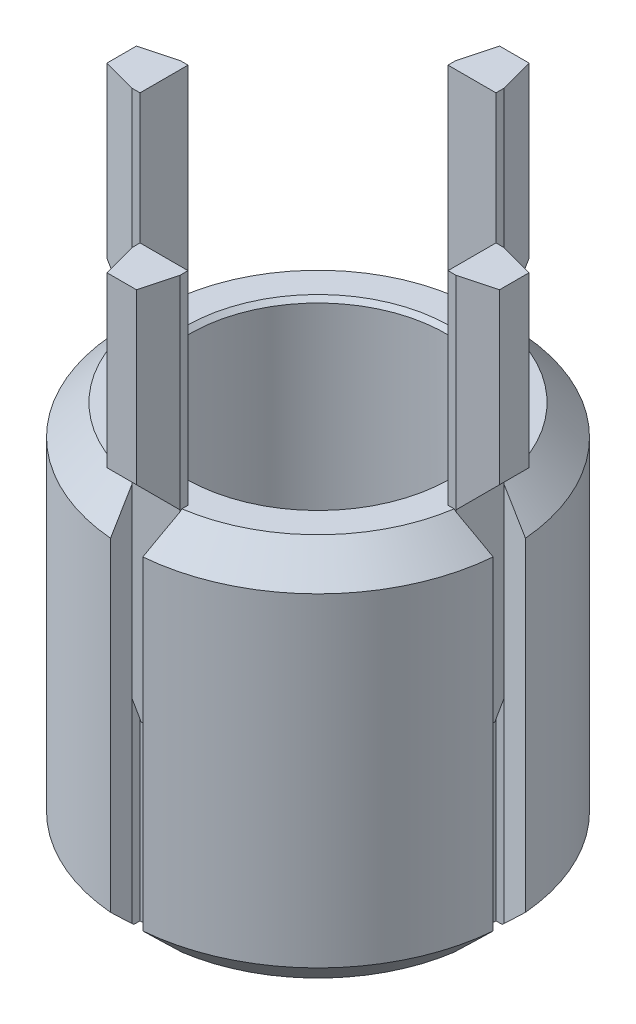
from build123d import *

# Parameters (mm, degrees)
SKETCH3_R           = 6
EXTRUDE1_DEPTH      = 12
CHAMFER1_SIZE       = 0.9375
EXTRUDE2_DEPTH      = 15.696938457
CIRPATTERN1_COUNT   = 4
SKETCH6_R           = 4
EXTRUDE3_DEPTH      = 15.679610971
SKETCH12_W          = 0.25
SKETCH12_H          = 1.5
EXTRUDE6_DEPTH      = 6.35
EXTRUDE7_DEPTH      = 6.35
EXTRUDE8_DEPTH      = 15.744069903
EXTRUDE8_DEPTH_BACK = 15.744069903
EXTRUDE9_DEPTH      = 18.368211193
CIRPATTERN2_COUNT   = 4


# Read off the part's stored shape, not the designer's step: Extrude4, Extrude5
with BuildPart() as part:
    # Sketch3 → Extrude1 (new body)
    with BuildSketch(Plane(origin=(0, 0, 0), x_dir=(1, 0, 0), z_dir=(0, 1, 0))):
        with Locations(Location((0, 0, 0), (0, 0, 270))):
            Circle(SKETCH3_R)
    extrude(amount=-EXTRUDE1_DEPTH)

    # Chamfer1
    chamfer1_edges = [part.edges().sort_by_distance(p)[0] for p in [
        (0, 0, -6),
        (0, -12, -6),
    ]]
    chamfer(chamfer1_edges, length=CHAMFER1_SIZE)

    # Sketch11 → Extrude2 (cut, through all)
    with BuildSketch(Plane(origin=(0, 0, 0), x_dir=(1, 0, 0), z_dir=(0, 1, 0))):
        Polygon((-6, 0.498797632), (-5.0625, 0.75), (-4.8125, 0.75), (-4.8125, -0.75), (-5.0625, -0.75), (-6, -0.498797632), align=None)
    extrude2 = extrude(amount=-EXTRUDE2_DEPTH, mode=Mode.SUBTRACT)

    # CirPattern1: Extrude2 ×4 about axis
    cirpattern1_axis = Axis((0, 0, 0), (0, 1, 0))
    for i in range(1, CIRPATTERN1_COUNT):
        add(extrude2.rotate(cirpattern1_axis, i * 360 / CIRPATTERN1_COUNT), mode=Mode.SUBTRACT)

    # Sketch6 → Extrude3 (cut, through all)
    with BuildSketch(Plane(origin=(0, 0, 0), x_dir=(1, 0, 0), z_dir=(0, 1, 0))):
        with Locations(Location((0, 0, 0), (0, 0, 270))):
            Circle(SKETCH6_R)
    extrude(amount=-EXTRUDE3_DEPTH, mode=Mode.SUBTRACT)

    # Extrude4 outline → Extrude4 (revolve, cut)
    with BuildSketch(Plane.XY):
        Polygon((4, 0), (4, -0.135316469), (4.135316469, 0), align=None)
    revolve(axis=Axis((0, 0, 0), (0, 1, 0)), mode=Mode.SUBTRACT)

    # Extrude5 outline → Extrude5 (revolve, cut)
    with BuildSketch(Plane.XY):
        Polygon((4.135316469, -12), (4, -11.864683531), (4, -12), align=None)
    revolve(axis=Axis((0, 0, 0), (0, 1, 0)), mode=Mode.SUBTRACT)


with BuildPart() as body_2:
    # Sketch12 → Extrude6 (new, symmetric)
    with BuildSketch(Plane(origin=(0, 0, 0), x_dir=(1, 0, 0), z_dir=(0, 1, 0))):
        with Locations((-4.9375, 0)):
            Rectangle(SKETCH12_W, SKETCH12_H)
    extrude(amount=EXTRUDE6_DEPTH, both=True)

    # Sketch13 → Extrude7 (add)
    with BuildSketch(Plane(origin=(0, 6.35, 0), x_dir=(1, 0, 0), z_dir=(0, 1, 0))):
        Polygon((-6.135316469, 0.462539693), (-5.0625, 0.75), (-5.0625, -0.75), (-6.135316469, -0.462539693), align=None)
    extrude(amount=-EXTRUDE7_DEPTH)

    # Sketch14 → Extrude8 (cut, two sides: drawn at the far end of the back side and taken through both)
    with BuildSketch(Plane.XY.offset(-EXTRUDE8_DEPTH_BACK)):
        Polygon((-6.135316469, 0), (-6.135316469, 1.072816469), (-5.0625, 0), align=None)
    extrude(amount=EXTRUDE8_DEPTH + EXTRUDE8_DEPTH_BACK, mode=Mode.SUBTRACT)

    # Sketch15 → Extrude9 (cut, through all)
    with BuildSketch(Plane.ZY.offset(5.0625)):
        Polygon((-0.462539693, -6.35), (-0.75, -5.852104144), (-0.75, -6.35), align=None)
        Polygon((0.462539693, -6.35), (0.75, -6.35), (0.75, -5.852104144), align=None)
    extrude(amount=-EXTRUDE9_DEPTH, mode=Mode.SUBTRACT)


with BuildPart() as cirpattern2_1:
    # CirPattern2: pattern copy
    add(body_2.part.rotate(Axis((0, 0, 0), (0, 1, 0)), 1 * 360 / CIRPATTERN2_COUNT))


with BuildPart() as cirpattern2_2:
    # CirPattern2: pattern copy
    add(body_2.part.rotate(Axis((0, 0, 0), (0, 1, 0)), 2 * 360 / CIRPATTERN2_COUNT))


with BuildPart() as cirpattern2_3:
    # CirPattern2: pattern copy
    add(body_2.part.rotate(Axis((0, 0, 0), (0, 1, 0)), 3 * 360 / CIRPATTERN2_COUNT))


solid = Compound([part.part, body_2.part, cirpattern2_1.part, cirpattern2_2.part, cirpattern2_3.part])
